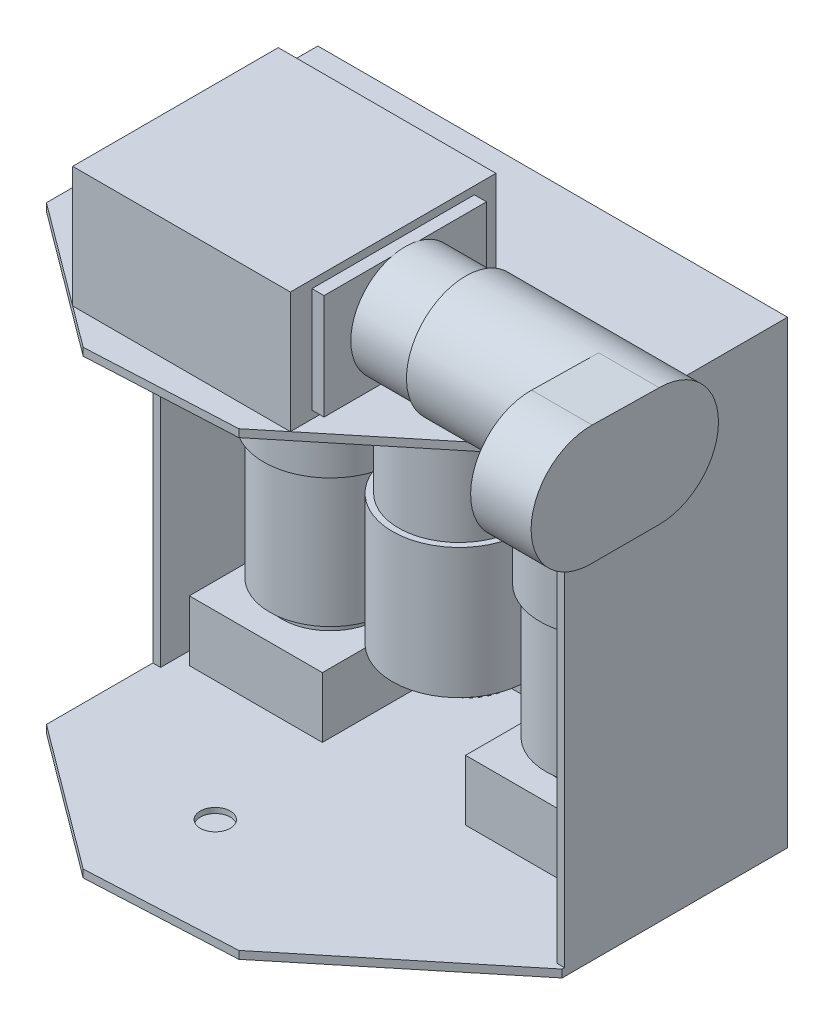
from build123d import *

# Parameters (mm, degrees)
BOSS_EXTRUDE1_DEPTH    = 3.2
SKETCH3_R              = 12.3
BOSS_EXTRUDE2_DEPTH    = 3.2
SKETCH4_R              = 4
BOSS_EXTRUDE3_DEPTH    = 4
SKETCH6_W              = 3.2
SKETCH6_H              = 65
BOSS_EXTRUDE4_DEPTH    = 190
SKETCH8_W              = 3.2
SKETCH8_H              = 89
BOSS_EXTRUDE5_DEPTH    = 190
SKETCH9_W              = 194.2
SKETCH9_H              = 190
BOSS_EXTRUDE7_DEPTH    = 3.2
SKETCH11_R             = 6.2
CUT_EXTRUDE2_DEPTH     = 94
SKETCH12_R             = 35
BOSS_EXTRUDE8_DEPTH    = 20
SKETCH14_W             = 90
SKETCH14_H             = 85
BOSS_EXTRUDE9_DEPTH    = 50
SKETCH19_W             = 67.169927248
SKETCH19_H             = 43.509036496
BOSS_EXTRUDE11_DEPTH   = 5
SKETCH20_R             = 22.5
BOSS_EXTRUDE12_DEPTH   = 25
SKETCH21_R             = 24.487458126
BOSS_EXTRUDE13_DEPTH   = 55
BOSS_EXTRUDE14_DEPTH   = 25
SKETCH25_W             = 55
SKETCH25_H             = 61.509308173
BOSS_EXTRUDE16_DEPTH   = 25
BOSS_EXTRUDE16_2_DEPTH = 25
SKETCH26_R             = 20
BOSS_EXTRUDE17_DEPTH   = 5
SKETCH27_R             = 25
BOSS_EXTRUDE18_DEPTH   = 55
SKETCH28_R             = 27.5
BOSS_EXTRUDE19_DEPTH   = 53.8
SKETCH29_R             = 10
BOSS_EXTRUDE20_DEPTH   = 4
SKETCH30_R             = 17.5
BOSS_EXTRUDE21_DEPTH   = 5
CUT_EXTRUDE4_DEPTH     = 5
CIRPATTERN1_COUNT      = 21
CIRPATTERN1_ANGLE      = 340
MIRROR2_COPY_1_DEPTH   = 5
MIRROR2_COPY_2_DEPTH   = 5
MIRROR2_COPY_3_DEPTH   = 5
MIRROR2_COPY_4_DEPTH   = 5
MIRROR2_COPY_5_DEPTH   = 5
MIRROR2_COPY_6_DEPTH   = 5
MIRROR2_COPY_7_DEPTH   = 5
MIRROR2_COPY_8_DEPTH   = 5
MIRROR2_COPY_9_DEPTH   = 5
MIRROR2_COPY_10_DEPTH  = 5
MIRROR2_COPY_11_DEPTH  = 5
MIRROR2_COPY_12_DEPTH  = 5
MIRROR2_COPY_13_DEPTH  = 5
MIRROR2_COPY_14_DEPTH  = 5
MIRROR2_COPY_15_DEPTH  = 5
MIRROR2_COPY_16_DEPTH  = 5
MIRROR2_COPY_17_DEPTH  = 5
MIRROR2_COPY_18_DEPTH  = 5
MIRROR2_COPY_19_DEPTH  = 5
MIRROR2_COPY_20_DEPTH  = 5
SKETCH32_W             = 60
SKETCH32_H             = 55
BOSS_EXTRUDE22_DEPTH   = 29
SKETCH33_R             = 20
BOSS_EXTRUDE23_DEPTH   = 5
SKETCH34_R             = 25
BOSS_EXTRUDE24_DEPTH   = 55
SKETCH35_R             = 27.5
BOSS_EXTRUDE25_DEPTH   = 53.8
SKETCH36_R             = 10
BOSS_EXTRUDE26_DEPTH   = 4
SKETCH37_R             = 17.5
BOSS_EXTRUDE27_DEPTH   = 5
CUT_EXTRUDE5_DEPTH     = 5
CIRPATTERN2_COUNT      = 40


with BuildPart() as part:
    # Sketch1 → Boss-Extrude1 (new body)
    with BuildSketch(Plane(origin=(0, 0, 0), x_dir=(1, 0, 0), z_dir=(0, 1, 0))):
        Polygon((-71.199297972, 0), (119.800702028, 0), (119.800702028, -90), (46.272924854, -150.155348756), (-15.035731115, -153.181069815), (-74.399297972, -109), (-74.399297972, -65), (-71.199297972, -65), align=None)
    boss_extrude1 = extrude(amount=BOSS_EXTRUDE1_DEPTH)

    # Sketch3 → Boss-Extrude2 (add)
    with BuildSketch(Plane.XZ):
        with Locations((-5.399297972, 108.199281837)):
            Circle(SKETCH3_R)
    boss_extrude2 = extrude(amount=BOSS_EXTRUDE2_DEPTH)

    # Sketch4 → Boss-Extrude3 (add)
    with BuildSketch(Plane.XZ.offset(3.2)):
        with Locations((-5.399297972, 108.199281837)):
            Circle(SKETCH4_R)
    boss_extrude3 = extrude(amount=BOSS_EXTRUDE3_DEPTH)

    # Sketch6 → Boss-Extrude4 (add)
    with BuildSketch(Plane(origin=(0, 0, 0), x_dir=(1, 0, 0), z_dir=(0, 1, 0))):
        with Locations((-72.799297972, -32.5)):
            Rectangle(SKETCH6_W, SKETCH6_H)
    extrude(amount=BOSS_EXTRUDE4_DEPTH)

    # Sketch8 → Boss-Extrude5 (add)
    with BuildSketch(Plane(origin=(0, 0, 0), x_dir=(1, 0, 0), z_dir=(0, 1, 0))):
        with Locations((118.200702028, -44.5)):
            Rectangle(SKETCH8_W, SKETCH8_H)
    extrude(amount=BOSS_EXTRUDE5_DEPTH)

    # Mirror1: Boss-Extrude1, Boss-Extrude2, Boss-Extrude3 across plane
    add(boss_extrude1.mirror(Plane(origin=(0, 95, 0), x_dir=(0, 0, 1), z_dir=(0, -1, 0))))
    add(boss_extrude2.mirror(Plane(origin=(0, 95, 0), x_dir=(0, 0, 1), z_dir=(0, -1, 0))))
    add(boss_extrude3.mirror(Plane(origin=(0, 95, 0), x_dir=(0, 0, 1), z_dir=(0, -1, 0))))

    # Sketch9 → Boss-Extrude7 (add)
    with BuildSketch(Plane.XY):
        with Locations((22.700702028, 95)):
            Rectangle(SKETCH9_W, SKETCH9_H)
    extrude(amount=-BOSS_EXTRUDE7_DEPTH)

    # Sketch11 → Cut-Extrude2 (cut, symmetric)
    with BuildSketch(Plane(origin=(0, 95, 0), x_dir=(1, 0, 0), z_dir=(0, 1, 0))):
        with Locations((-5.399297972, -108.199281837)):
            Circle(SKETCH11_R)
    extrude(amount=CUT_EXTRUDE2_DEPTH, both=True, mode=Mode.SUBTRACT)

    # Sketch12 → Boss-Extrude8 (add)
    with BuildSketch(Plane(origin=(0, 0, -3.2), x_dir=(-1, 0, 0), z_dir=(0, 0, -1))):
        with Locations((-22.700702028, 95)):
            Circle(SKETCH12_R)
    extrude(amount=BOSS_EXTRUDE8_DEPTH)

    # Sketch14 → Boss-Extrude9 (add)
    with BuildSketch(Plane(origin=(0, 190, 0), x_dir=(1, 0, 0), z_dir=(0, 1, 0))):
        with Locations((13.00356987, -98.058145234)):
            Rectangle(SKETCH14_W, SKETCH14_H)
    extrude(amount=BOSS_EXTRUDE9_DEPTH)

    # Sketch19 → Boss-Extrude11 (add)
    with BuildSketch(Plane(origin=(58.00356987, 0, 0), x_dir=(0, 0, -1), z_dir=(1, 0, 0))):
        with Locations((-98.058145234, 215)):
            Rectangle(SKETCH19_W, SKETCH19_H)
    extrude(amount=BOSS_EXTRUDE11_DEPTH)

    # Sketch20 → Boss-Extrude12 (add)
    with BuildSketch(Plane(origin=(63.00356987, 0, 0), x_dir=(0, 0, -1), z_dir=(1, 0, 0))):
        with Locations((-98.058145234, 215)):
            Circle(SKETCH20_R)
    extrude(amount=BOSS_EXTRUDE12_DEPTH)

    # Sketch21 → Boss-Extrude13 (add)
    with BuildSketch(Plane(origin=(88.00356987, 0, 0), x_dir=(0, 0, -1), z_dir=(1, 0, 0))):
        with Locations((-98.058145234, 215)):
            Circle(SKETCH21_R)
    extrude(amount=BOSS_EXTRUDE13_DEPTH)

    # Sketch22 → Boss-Extrude14 (add)
    with BuildSketch(Plane(origin=(143.00356987, 0, 0), x_dir=(0, 0, -1), z_dir=(1, 0, 0))):
        with BuildLine():
            Line((-98.058145234, 239.487458126), (-125.826751911, 240))
            ThreePointArc((-125.826751911, 240), (-151.027190863, 215.712980826), (-126.740171689, 190.512541874))
            Line((-126.740171689, 190.512541874), (-98.058145234, 190.512541874))
            ThreePointArc((-98.058145234, 190.512541874), (-73.570687109, 215), (-98.058145234, 239.487458126))
        make_face()
    extrude(amount=BOSS_EXTRUDE14_DEPTH)

    # Sketch32 → Boss-Extrude22 (add)
    with BuildSketch(Plane.XZ.offset(-186.8)):
        with Locations((22.700702028, 35.812904987)):
            Rectangle(SKETCH32_W, SKETCH32_H)
    extrude(amount=BOSS_EXTRUDE22_DEPTH)

    # Sketch33 → Boss-Extrude23 (add)
    with BuildSketch(Plane.XZ.offset(-157.8)):
        with Locations((22.700702028, 35.508982279)):
            Circle(SKETCH33_R)
    extrude(amount=BOSS_EXTRUDE23_DEPTH)

    # Sketch34 → Boss-Extrude24 (add)
    with BuildSketch(Plane.XZ.offset(-152.8)):
        with Locations((22.700702028, 35.508982279)):
            Circle(SKETCH34_R)
    extrude(amount=BOSS_EXTRUDE24_DEPTH)

    # Sketch35 → Boss-Extrude25 (add)
    with BuildSketch(Plane.XZ.offset(-97.8)):
        with Locations((22.700702028, 35.508982279)):
            Circle(SKETCH35_R)
    extrude(amount=BOSS_EXTRUDE25_DEPTH)

    # Sketch36 → Boss-Extrude26 (add)
    with BuildSketch(Plane.XZ.offset(-44)):
        with Locations((22.700702028, 35.508982279)):
            Circle(SKETCH36_R)
    extrude(amount=BOSS_EXTRUDE26_DEPTH)

    # Sketch37 → Boss-Extrude27 (add)
    with BuildSketch(Plane.XZ.offset(-40)):
        with Locations((22.700702028, 31.801873123)):
            Circle(SKETCH37_R)
    extrude(amount=BOSS_EXTRUDE27_DEPTH)

    # Sketch38 → Cut-Extrude5 (cut)
    with BuildSketch(Plane.XZ.offset(-35)):
        with BuildLine():
            Line((20.880102987, 49.053336905), (21.179363396, 46.217632834))
            ThreePointArc((21.179363396, 46.217632834), (22.020308441, 45.537239247), (22.700702028, 46.378184292))
            Line((22.700702028, 46.378184292), (23.311488244, 49.176135451))
            ThreePointArc((23.311488244, 49.176135451), (22.082300234, 49.381941892), (20.880102987, 49.053336905))
        make_face()
    cut_extrude5 = extrude(amount=-CUT_EXTRUDE5_DEPTH, mode=Mode.SUBTRACT)

    # CirPattern2: Cut-Extrude5 ×40 about axis
    cirpattern2_axis = Axis((22.700702028, 35, 31.801873123), (0, -1, 0))
    for i in range(1, CIRPATTERN2_COUNT):
        add(cut_extrude5.rotate(cirpattern2_axis, i * 360 / CIRPATTERN2_COUNT), mode=Mode.SUBTRACT)


with BuildPart() as body_2:
    # Sketch25 → Boss-Extrude16 (new body)
    with BuildSketch(Plane(origin=(0, 7.2, 0), x_dir=(1, 0, 0), z_dir=(0, 1, 0))):
        with Locations((-34.399297972, -31.669528177)):
            Rectangle(SKETCH25_W, SKETCH25_H)
    extrude(amount=BOSS_EXTRUDE16_DEPTH)


with BuildPart() as body_3:
    # Sketch25 → Boss-Extrude16 2 (new body)
    with BuildSketch(Plane(origin=(0, 7.2, 0), x_dir=(1, 0, 0), z_dir=(0, 1, 0))):
        with Locations((79.800702028, -31.669528177)):
            Rectangle(SKETCH25_W, SKETCH25_H)
    extrude(amount=BOSS_EXTRUDE16_2_DEPTH)

    # Sketch26 → Boss-Extrude17 (add)
    with BuildSketch(Plane(origin=(0, 32.2, 0), x_dir=(1, 0, 0), z_dir=(0, 1, 0))):
        with Locations((79.800702028, -31.669528176)):
            Circle(SKETCH26_R)
    boss_extrude17 = extrude(amount=BOSS_EXTRUDE17_DEPTH)

    # Sketch27 → Boss-Extrude18 (add)
    with BuildSketch(Plane(origin=(0, 37.2, 0), x_dir=(1, 0, 0), z_dir=(0, 1, 0))):
        with Locations((79.800702028, -31.669528176)):
            Circle(SKETCH27_R)
    boss_extrude18 = extrude(amount=BOSS_EXTRUDE18_DEPTH)

    # Sketch28 → Boss-Extrude19 (add)
    with BuildSketch(Plane(origin=(0, 92.2, 0), x_dir=(1, 0, 0), z_dir=(0, 1, 0))):
        with Locations((79.800702028, -31.669528176)):
            Circle(SKETCH28_R)
    boss_extrude19 = extrude(amount=BOSS_EXTRUDE19_DEPTH)

    # Sketch29 → Boss-Extrude20 (add)
    with BuildSketch(Plane(origin=(0, 146, 0), x_dir=(1, 0, 0), z_dir=(0, 1, 0))):
        with Locations((79.800702028, -31.669528176)):
            Circle(SKETCH29_R)
    boss_extrude20 = extrude(amount=BOSS_EXTRUDE20_DEPTH)

    # Sketch30 → Boss-Extrude21 (add)
    with BuildSketch(Plane(origin=(0, 150, 0), x_dir=(1, 0, 0), z_dir=(0, 1, 0))):
        with Locations((79.800702028, -31.669528176)):
            Circle(SKETCH30_R)
    boss_extrude21 = extrude(amount=BOSS_EXTRUDE21_DEPTH)

    # Sketch31 → Cut-Extrude4 (cut)
    with BuildSketch(Plane(origin=(0, 155, 0), x_dir=(1, 0, 0), z_dir=(0, 1, 0))):
        with BuildLine():
            Line((62.527945249, -34.480555257), (64.507061824, -33.115227786))
            ThreePointArc((64.507061824, -33.115227786), (65.218691848, -31.616503481), (64.276573539, -30.25085165))
            Line((64.276573539, -30.25085165), (62.450611652, -29.383841421))
            ThreePointArc((62.450611652, -29.383841421), (62.302716165, -31.935029091), (62.527945249, -34.480555257))
        make_face()
    cut_extrude4 = extrude(amount=-CUT_EXTRUDE4_DEPTH, mode=Mode.SUBTRACT)

    # CirPattern1: Cut-Extrude4 ×21 about axis
    cirpattern1_axis = Axis((79.800702028, 155, 31.669528176), (0, 1, 0))
    for i in range(1, CIRPATTERN1_COUNT):
        add(cut_extrude4.rotate(cirpattern1_axis, i * CIRPATTERN1_ANGLE / (CIRPATTERN1_COUNT - 1)), mode=Mode.SUBTRACT)


with BuildPart() as body_2_1:
    add(body_2.part)

    # Mirror2: Boss-Extrude17, Boss-Extrude18, Boss-Extrude19, Boss-Extrude20, Boss-Extrude21, Cut-Extrude4 across plane
    add(boss_extrude17.mirror(Plane.ZY.offset(-22.700702028)))
    add(boss_extrude18.mirror(Plane.ZY.offset(-22.700702028)))
    add(boss_extrude19.mirror(Plane.ZY.offset(-22.700702028)))
    add(boss_extrude20.mirror(Plane.ZY.offset(-22.700702028)))
    add(boss_extrude21.mirror(Plane.ZY.offset(-22.700702028)))
    add(cut_extrude4.mirror(Plane.ZY.offset(-22.700702028)), mode=Mode.SUBTRACT)

    # Mirror2 copy 1 sketch → Mirror2 copy 1 (cut)
    with BuildSketch(Plane(origin=(51.173766847, 155, 24.715275052), x_dir=(-0.9563047559630355, 0, -0.2923717047227368), z_dir=(0, 1, 0))):
        with BuildLine():
            Line((62.527945249, 34.480555257), (64.507061824, 33.115227786))
            ThreePointArc((64.507061824, 33.115227786), (65.218691848, 31.616503481), (64.276573539, 30.25085165))
            Line((64.276573539, 30.25085165), (62.450611652, 29.383841421))
            ThreePointArc((62.450611652, 29.383841421), (62.302716165, 31.935029091), (62.527945249, 34.480555257))
        make_face()
    extrude(amount=-MIRROR2_COPY_1_DEPTH, mode=Mode.SUBTRACT)

    # Mirror2 copy 2 sketch → Mirror2 copy 2 (cut)
    with BuildSketch(Plane(origin=(49.467857738, 155, 50.038285679), x_dir=(-0.8290375725550413, 0, -0.5591929034707476), z_dir=(0, 1, 0))):
        with BuildLine():
            Line((62.527945249, 34.480555257), (64.507061824, 33.115227786))
            ThreePointArc((64.507061824, 33.115227786), (65.218691848, 31.616503481), (64.276573539, 30.25085165))
            Line((64.276573539, 30.25085165), (62.450611652, 29.383841421))
            ThreePointArc((62.450611652, 29.383841421), (62.302716165, 31.935029091), (62.527945249, 34.480555257))
        make_face()
    extrude(amount=-MIRROR2_COPY_2_DEPTH, mode=Mode.SUBTRACT)

    # Mirror2 copy 3 sketch → Mirror2 copy 3 (cut)
    with BuildSketch(Plane(origin=(40.432756958, 155, 73.756041622), x_dir=(-0.6293203910498364, 0, -0.7771459614569718), z_dir=(0, 1, 0))):
        with BuildLine():
            Line((62.527945249, 34.480555257), (64.507061824, 33.115227786))
            ThreePointArc((64.507061824, 33.115227786), (65.218691848, 31.616503481), (64.276573539, 30.25085165))
            Line((64.276573539, 30.25085165), (62.450611652, 29.383841421))
            ThreePointArc((62.450611652, 29.383841421), (62.302716165, 31.935029091), (62.527945249, 34.480555257))
        make_face()
    extrude(amount=-MIRROR2_COPY_3_DEPTH, mode=Mode.SUBTRACT)

    # Mirror2 copy 4 sketch → Mirror2 copy 4 (cut)
    with BuildSketch(Plane(origin=(24.858046374, 155, 93.795836614), x_dir=(-0.37460659341591007, 0, -0.9271838545667882), z_dir=(0, 1, 0))):
        with BuildLine():
            Line((62.527945249, 34.480555257), (64.507061824, 33.115227786))
            ThreePointArc((64.507061824, 33.115227786), (65.218691848, 31.616503481), (64.276573539, 30.25085165))
            Line((64.276573539, 30.25085165), (62.450611652, 29.383841421))
            ThreePointArc((62.450611652, 29.383841421), (62.302716165, 31.935029091), (62.527945249, 34.480555257))
        make_face()
    extrude(amount=-MIRROR2_COPY_4_DEPTH, mode=Mode.SUBTRACT)

    # Mirror2 copy 5 sketch → Mirror2 copy 5 (cut)
    with BuildSketch(Plane(origin=(4.104807545, 155, 108.40638319), x_dir=(-0.0871557427476554, 0, -0.9961946980917459), z_dir=(0, 1, 0))):
        with BuildLine():
            Line((62.527945249, 34.480555257), (64.507061824, 33.115227786))
            ThreePointArc((64.507061824, 33.115227786), (65.218691848, 31.616503481), (64.276573539, 30.25085165))
            Line((64.276573539, 30.25085165), (62.450611652, 29.383841421))
            ThreePointArc((62.450611652, 29.383841421), (62.302716165, 31.935029091), (62.527945249, 34.480555257))
        make_face()
    extrude(amount=-MIRROR2_COPY_5_DEPTH, mode=Mode.SUBTRACT)

    # Mirror2 copy 6 sketch → Mirror2 copy 6 (cut)
    with BuildSketch(Plane(origin=(-20.013323857, 155, 116.310858552), x_dir=(0.20791169081776267, 0, -0.9781476007338049), z_dir=(0, 1, 0))):
        with BuildLine():
            Line((62.527945249, 34.480555257), (64.507061824, 33.115227786))
            ThreePointArc((64.507061824, 33.115227786), (65.218691848, 31.616503481), (64.276573539, 30.25085165))
            Line((64.276573539, 30.25085165), (62.450611652, 29.383841421))
            ThreePointArc((62.450611652, 29.383841421), (62.302716165, 31.935029091), (62.527945249, 34.480555257))
        make_face()
    extrude(amount=-MIRROR2_COPY_6_DEPTH, mode=Mode.SUBTRACT)

    # Mirror2 copy 7 sketch → Mirror2 copy 7 (cut)
    with BuildSketch(Plane(origin=(-45.388652559, 155, 116.818486742), x_dir=(0.4848096202463408, 0, -0.8746197071393937), z_dir=(0, 1, 0))):
        with BuildLine():
            Line((62.527945249, 34.480555257), (64.507061824, 33.115227786))
            ThreePointArc((64.507061824, 33.115227786), (65.218691848, 31.616503481), (64.276573539, 30.25085165))
            Line((64.276573539, 30.25085165), (62.450611652, 29.383841421))
            ThreePointArc((62.450611652, 29.383841421), (62.302716165, 31.935029091), (62.527945249, 34.480555257))
        make_face()
    extrude(amount=-MIRROR2_COPY_7_DEPTH, mode=Mode.SUBTRACT)

    # Mirror2 copy 8 sketch → Mirror2 copy 8 (cut)
    with BuildSketch(Plane(origin=(-69.8036162, 155, 109.884905884), x_dir=(0.7193398003386545, 0, -0.6946583704589938), z_dir=(0, 1, 0))):
        with BuildLine():
            Line((62.527945249, 34.480555257), (64.507061824, 33.115227786))
            ThreePointArc((64.507061824, 33.115227786), (65.218691848, 31.616503481), (64.276573539, 30.25085165))
            Line((64.276573539, 30.25085165), (62.450611652, 29.383841421))
            ThreePointArc((62.450611652, 29.383841421), (62.302716165, 31.935029091), (62.527945249, 34.480555257))
        make_face()
    extrude(amount=-MIRROR2_COPY_8_DEPTH, mode=Mode.SUBTRACT)

    # Mirror2 copy 9 sketch → Mirror2 copy 9 (cut)
    with BuildSketch(Plane(origin=(-91.12457919, 155, 96.116044993), x_dir=(0.8910065241883705, 0, -0.45399049973954186), z_dir=(0, 1, 0))):
        with BuildLine():
            Line((62.527945249, 34.480555257), (64.507061824, 33.115227786))
            ThreePointArc((64.507061824, 33.115227786), (65.218691848, 31.616503481), (64.276573539, 30.25085165))
            Line((64.276573539, 30.25085165), (62.450611652, 29.383841421))
            ThreePointArc((62.450611652, 29.383841421), (62.302716165, 31.935029091), (62.527945249, 34.480555257))
        make_face()
    extrude(amount=-MIRROR2_COPY_9_DEPTH, mode=Mode.SUBTRACT)

    # Mirror2 copy 10 sketch → Mirror2 copy 10 (cut)
    with BuildSketch(Plane(origin=(-107.48829217, 155, 76.715171542), x_dir=(0.9848077530122091, 0, -0.17364817766692428), z_dir=(0, 1, 0))):
        with BuildLine():
            Line((62.527945249, 34.480555257), (64.507061824, 33.115227786))
            ThreePointArc((64.507061824, 33.115227786), (65.218691848, 31.616503481), (64.276573539, 30.25085165))
            Line((64.276573539, 30.25085165), (62.450611652, 29.383841421))
            ThreePointArc((62.450611652, 29.383841421), (62.302716165, 31.935029091), (62.527945249, 34.480555257))
        make_face()
    extrude(amount=-MIRROR2_COPY_10_DEPTH, mode=Mode.SUBTRACT)

    # Mirror2 copy 11 sketch → Mirror2 copy 11 (cut)
    with BuildSketch(Plane(origin=(-117.464722273, 155, 53.377737333), x_dir=(0.9925461516413212, 0, 0.12186934340515422), z_dir=(0, 1, 0))):
        with BuildLine():
            Line((62.527945249, 34.480555257), (64.507061824, 33.115227786))
            ThreePointArc((64.507061824, 33.115227786), (65.218691848, 31.616503481), (64.276573539, 30.25085165))
            Line((64.276573539, 30.25085165), (62.450611652, 29.383841421))
            ThreePointArc((62.450611652, 29.383841421), (62.302716165, 31.935029091), (62.527945249, 34.480555257))
        make_face()
    extrude(amount=-MIRROR2_COPY_11_DEPTH, mode=Mode.SUBTRACT)

    # Mirror2 copy 12 sketch → Mirror2 copy 12 (cut)
    with BuildSketch(Plane(origin=(-120.182024405, 155, 28.14321213), x_dir=(0.9135454576425979, 0, 0.406736643075807), z_dir=(0, 1, 0))):
        with BuildLine():
            Line((62.527945249, 34.480555257), (64.507061824, 33.115227786))
            ThreePointArc((64.507061824, 33.115227786), (65.218691848, 31.616503481), (64.276573539, 30.25085165))
            Line((64.276573539, 30.25085165), (62.450611652, 29.383841421))
            ThreePointArc((62.450611652, 29.383841421), (62.302716165, 31.935029091), (62.527945249, 34.480555257))
        make_face()
    extrude(amount=-MIRROR2_COPY_12_DEPTH, mode=Mode.SUBTRACT)

    # Mirror2 copy 13 sketch → Mirror2 copy 13 (cut)
    with BuildSketch(Plane(origin=(-115.402732205, 155, 3.216853407), x_dir=(0.7547095802227664, 0, 0.6560590289905137), z_dir=(0, 1, 0))):
        with BuildLine():
            Line((62.527945249, 34.480555257), (64.507061824, 33.115227786))
            ThreePointArc((64.507061824, 33.115227786), (65.218691848, 31.616503481), (64.276573539, 30.25085165))
            Line((64.276573539, 30.25085165), (62.450611652, 29.383841421))
            ThreePointArc((62.450611652, 29.383841421), (62.302716165, 31.935029091), (62.527945249, 34.480555257))
        make_face()
    extrude(amount=-MIRROR2_COPY_13_DEPTH, mode=Mode.SUBTRACT)

    # Mirror2 copy 14 sketch → Mirror2 copy 14 (cut)
    with BuildSketch(Plane(origin=(-103.544510352, 155, -19.22301218), x_dir=(0.5299192642331971, 0, 0.8480480961564307), z_dir=(0, 1, 0))):
        with BuildLine():
            Line((62.527945249, 34.480555257), (64.507061824, 33.115227786))
            ThreePointArc((64.507061824, 33.115227786), (65.218691848, 31.616503481), (64.276573539, 30.25085165))
            Line((64.276573539, 30.25085165), (62.450611652, 29.383841421))
            ThreePointArc((62.450611652, 29.383841421), (62.302716165, 31.935029091), (62.527945249, 34.480555257))
        make_face()
    extrude(amount=-MIRROR2_COPY_14_DEPTH, mode=Mode.SUBTRACT)

    # Mirror2 copy 15 sketch → Mirror2 copy 15 (cut)
    with BuildSketch(Plane(origin=(-85.643654642, 155, -37.215353827), x_dir=(0.2588190451025109, 0, 0.965925826289071), z_dir=(0, 1, 0))):
        with BuildLine():
            Line((62.527945249, 34.480555257), (64.507061824, 33.115227786))
            ThreePointArc((64.507061824, 33.115227786), (65.218691848, 31.616503481), (64.276573539, 30.25085165))
            Line((64.276573539, 30.25085165), (62.450611652, 29.383841421))
            ThreePointArc((62.450611652, 29.383841421), (62.302716165, 31.935029091), (62.527945249, 34.480555257))
        make_face()
    extrude(amount=-MIRROR2_COPY_15_DEPTH, mode=Mode.SUBTRACT)

    # Mirror2 copy 16 sketch → Mirror2 copy 16 (cut)
    with BuildSketch(Plane(origin=(-63.26452959, 155, -49.187812014), x_dir=(-0.03489949670251135, 0, 0.9993908270190953), z_dir=(0, 1, 0))):
        with BuildLine():
            Line((62.527945249, 34.480555257), (64.507061824, 33.115227786))
            ThreePointArc((64.507061824, 33.115227786), (65.218691848, 31.616503481), (64.276573539, 30.25085165))
            Line((64.276573539, 30.25085165), (62.450611652, 29.383841421))
            ThreePointArc((62.450611652, 29.383841421), (62.302716165, 31.935029091), (62.527945249, 34.480555257))
        make_face()
    extrude(amount=-MIRROR2_COPY_16_DEPTH, mode=Mode.SUBTRACT)

    # Mirror2 copy 17 sketch → Mirror2 copy 17 (cut)
    with BuildSketch(Plane(origin=(-38.36285786, 155, -54.094107778), x_dir=(-0.3255681544571675, 0, 0.9455185755993131), z_dir=(0, 1, 0))):
        with BuildLine():
            Line((62.527945249, 34.480555257), (64.507061824, 33.115227786))
            ThreePointArc((64.507061824, 33.115227786), (65.218691848, 31.616503481), (64.276573539, 30.25085165))
            Line((64.276573539, 30.25085165), (62.450611652, 29.383841421))
            ThreePointArc((62.450611652, 29.383841421), (62.302716165, 31.935029091), (62.527945249, 34.480555257))
        make_face()
    extrude(amount=-MIRROR2_COPY_17_DEPTH, mode=Mode.SUBTRACT)

    # Mirror2 copy 18 sketch → Mirror2 copy 18 (cut)
    with BuildSketch(Plane(origin=(-13.114808696, 155, -51.505477536), x_dir=(-0.5877852522924826, 0, 0.8090169943749406), z_dir=(0, 1, 0))):
        with BuildLine():
            Line((62.527945249, 34.480555257), (64.507061824, 33.115227786))
            ThreePointArc((64.507061824, 33.115227786), (65.218691848, 31.616503481), (64.276573539, 30.25085165))
            Line((64.276573539, 30.25085165), (62.450611652, 29.383841421))
            ThreePointArc((62.450611652, 29.383841421), (62.302716165, 31.935029091), (62.527945249, 34.480555257))
        make_face()
    extrude(amount=-MIRROR2_COPY_18_DEPTH, mode=Mode.SUBTRACT)

    # Mirror2 copy 19 sketch → Mirror2 copy 19 (cut)
    with BuildSketch(Plane(origin=(10.273178561, 155, -41.64814295), x_dir=(-0.7986355100472999, 0, 0.6018150231520388), z_dir=(0, 1, 0))):
        with BuildLine():
            Line((62.527945249, 34.480555257), (64.507061824, 33.115227786))
            ThreePointArc((64.507061824, 33.115227786), (65.218691848, 31.616503481), (64.276573539, 30.25085165))
            Line((64.276573539, 30.25085165), (62.450611652, 29.383841421))
            ThreePointArc((62.450611652, 29.383841421), (62.302716165, 31.935029091), (62.527945249, 34.480555257))
        make_face()
    extrude(amount=-MIRROR2_COPY_19_DEPTH, mode=Mode.SUBTRACT)

    # Mirror2 copy 20 sketch → Mirror2 copy 20 (cut)
    with BuildSketch(Plane(origin=(29.757216291, 155, -25.3835413), x_dir=(-0.9396926207859128, 0, 0.3420201433256566), z_dir=(0, 1, 0))):
        with BuildLine():
            Line((62.527945249, 34.480555257), (64.507061824, 33.115227786))
            ThreePointArc((64.507061824, 33.115227786), (65.218691848, 31.616503481), (64.276573539, 30.25085165))
            Line((64.276573539, 30.25085165), (62.450611652, 29.383841421))
            ThreePointArc((62.450611652, 29.383841421), (62.302716165, 31.935029091), (62.527945249, 34.480555257))
        make_face()
    extrude(amount=-MIRROR2_COPY_20_DEPTH, mode=Mode.SUBTRACT)


solid = Compound([part.part, body_3.part, body_2_1.part])
